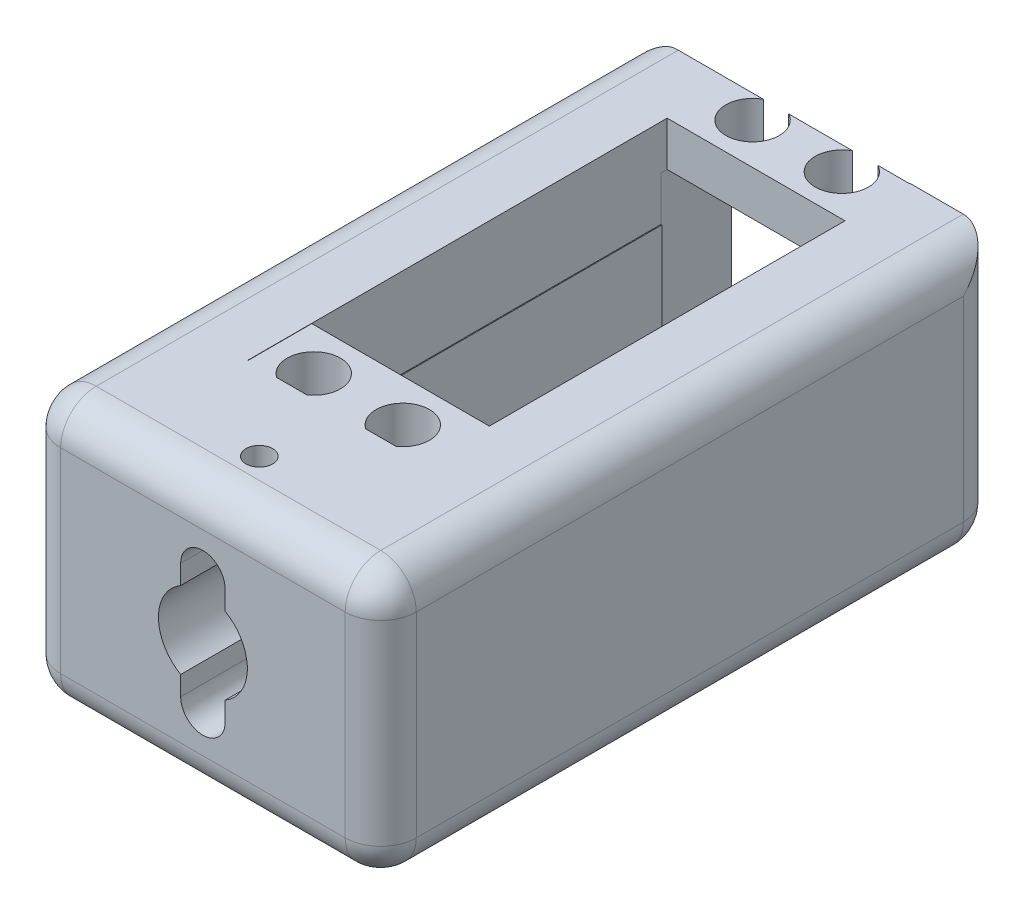
from build123d import *

# Parameters (mm, degrees)
SKETCH3_W            = 19.970710678
SKETCH3_H            = 7.220710678
BOSS_EXTRUDE2_DEPTH  = 10
SKETCH4_W            = 54.526496071
SKETCH4_H            = 10
BOSS_EXTRUDE3_DEPTH  = 10
SKETCH5_W            = 7.25
SKETCH5_H            = 10.1
BOSS_EXTRUDE4_DEPTH  = 20
SKETCH6_W            = 54.470710678
SKETCH6_H            = 10
BOSS_EXTRUDE5_DEPTH  = 10
SKETCH7_R            = 3
SKETCH7_R_2          = 2.998828916
CUT_EXTRUDE1_DEPTH   = 12
SKETCH8_R            = 3
CUT_EXTRUDE2_DEPTH   = 12
SKETCH9_W            = 40
SKETCH9_H            = 54.526496071
SKETCH9_W_2          = 19.9
SKETCH9_H_2          = 40
BOSS_EXTRUDE8_DEPTH  = 12
SKETCH10_W           = 20.059980773
SKETCH10_H           = 17
CUT_EXTRUDE6_DEPTH   = 8
SKETCH11_W           = 40
SKETCH11_H           = 22
BOSS_EXTRUDE9_DEPTH  = 5
SKETCH12_W           = 7.25
SKETCH12_H           = 0.1
CUT_EXTRUDE7_DEPTH   = 20
SKETCH13_W           = 20
SKETCH13_H           = 17
CUT_EXTRUDE8_DEPTH   = 20
SKETCH16_W           = 40
SKETCH16_H           = 59.526496071
BOSS_EXTRUDE11_DEPTH = 8
SKETCH17_W           = 20
SKETCH17_H           = 40
CUT_EXTRUDE10_DEPTH  = 5
SKETCH19_W           = 40
SKETCH19_H           = 30
BOSS_EXTRUDE12_DEPTH = 10
CUT_EXTRUDE11_DEPTH  = 8
SKETCH21_R           = 1.5
CUT_EXTRUDE12_DEPTH  = 30
FILLET2_R            = 4


with BuildPart() as part:
    # Sketch3 → Boss-Extrude2 (new body)
    with BuildSketch(Plane.XZ.offset(-27.7)):
        with Locations((0.014644661, 3.610355339)):
            Rectangle(SKETCH3_W, SKETCH3_H)
    extrude(amount=BOSS_EXTRUDE2_DEPTH)

    # Sketch4 → Boss-Extrude3 (add)
    with BuildSketch(Plane(origin=(10, 0, 0), x_dir=(0, 0, -1), z_dir=(1, 0, 0))):
        with Locations((20.042537357, 22.7)):
            Rectangle(SKETCH4_W, SKETCH4_H)
    extrude(amount=BOSS_EXTRUDE3_DEPTH)

    # Sketch5 → Boss-Extrude4 (add)
    with BuildSketch(Plane.ZY.offset(-10)):
        with Locations((-43.625, 22.75)):
            Rectangle(SKETCH5_W, SKETCH5_H)
    extrude(amount=BOSS_EXTRUDE4_DEPTH)

    # Sketch6 → Boss-Extrude5 (add)
    with BuildSketch(Plane.ZY.offset(10)):
        with Locations((-20.014644661, 22.7)):
            Rectangle(SKETCH6_W, SKETCH6_H)
    extrude(amount=BOSS_EXTRUDE5_DEPTH)

    # Sketch7 → Cut-Extrude1 (cut)
    with BuildSketch(Plane(origin=(0, 27.8, 0), x_dir=(1, 0, 0), z_dir=(0, 1, 0))):
        with Locations((-5.000552171, 44.609234731)):
            Circle(SKETCH7_R)
        with Locations((5.037134364, 44.609234731)):
            Circle(SKETCH7_R_2)
    extrude(amount=-CUT_EXTRUDE1_DEPTH, mode=Mode.SUBTRACT)

    # Sketch8 → Cut-Extrude2 (cut)
    with BuildSketch(Plane(origin=(0, 27.7, 0), x_dir=(1, 0, 0), z_dir=(0, 1, 0))):
        with Locations((-5, -4.75)):
            Circle(SKETCH8_R)
        with Locations((5.014644661, -4.75)):
            Circle(SKETCH8_R)
    extrude(amount=-CUT_EXTRUDE2_DEPTH, mode=Mode.SUBTRACT)

    # Sketch9 → Boss-Extrude8 (add)
    with BuildSketch(Plane.XZ.offset(-17.7)):
        with Locations((0, -20.042537357)):
            Rectangle(SKETCH9_W, SKETCH9_H)
        with Locations((0.05, -20)):
            Rectangle(SKETCH9_W_2, SKETCH9_H_2, mode=Mode.SUBTRACT)
    extrude(amount=BOSS_EXTRUDE8_DEPTH)

    # Sketch10 → Cut-Extrude6 (cut)
    with BuildSketch(Plane(origin=(0, 0, -47.305785393), x_dir=(-1, 0, 0), z_dir=(0, 0, -1))):
        with Locations((0.029990387, 14.2)):
            Rectangle(SKETCH10_W, SKETCH10_H)
    extrude(amount=-CUT_EXTRUDE6_DEPTH, mode=Mode.SUBTRACT)

    # Sketch11 → Boss-Extrude9 (add)
    with BuildSketch(Plane.XY.offset(7.220710678)):
        with Locations((0, 16.7)):
            Rectangle(SKETCH11_W, SKETCH11_H)
    extrude(amount=BOSS_EXTRUDE9_DEPTH)

    # Sketch12 → Cut-Extrude7 (cut)
    with BuildSketch(Plane(origin=(10, 0, 0), x_dir=(0, 0, -1), z_dir=(1, 0, 0))):
        with Locations((43.625, 27.75)):
            Rectangle(SKETCH12_W, SKETCH12_H)
    extrude(amount=-CUT_EXTRUDE7_DEPTH, mode=Mode.SUBTRACT)

    # Sketch13 → Cut-Extrude8 (cut)
    with BuildSketch(Plane.XY.offset(12.220710678)):
        with Locations((0, 14.2)):
            Rectangle(SKETCH13_W, SKETCH13_H)
    extrude(amount=-CUT_EXTRUDE8_DEPTH, mode=Mode.SUBTRACT)

    # Sketch16 → Boss-Extrude11 (add)
    with BuildSketch(Plane.XZ.offset(-5.7)):
        with Locations((0, -17.542537357)):
            Rectangle(SKETCH16_W, SKETCH16_H)
    extrude(amount=BOSS_EXTRUDE11_DEPTH)

    # Sketch17 → Cut-Extrude10 (cut)
    with BuildSketch(Plane(origin=(0, 5.7, 0), x_dir=(1, 0, 0), z_dir=(0, 1, 0))):
        with Locations((0, 20)):
            Rectangle(SKETCH17_W, SKETCH17_H)
    extrude(amount=-CUT_EXTRUDE10_DEPTH, mode=Mode.SUBTRACT)

    # Sketch19 → Boss-Extrude12 (add)
    with BuildSketch(Plane.XY.offset(12.220710678)):
        with Locations((0, 12.7)):
            Rectangle(SKETCH19_W, SKETCH19_H)
    extrude(amount=BOSS_EXTRUDE12_DEPTH)

    # Sketch20 → Cut-Extrude11 (cut)
    with BuildSketch(Plane.XY.offset(22.220710678)):
        with BuildLine():
            Line((-2.5, 6.2), (-2.5, 8.369872981))
            ThreePointArc((-2.5, 8.369872981), (-5, 12.7), (-2.5, 17.030127019))
            Line((-2.5, 17.030127019), (-2.5, 19.2))
            ThreePointArc((-2.5, 19.2), (0, 21.7), (2.5, 19.2))
            Line((2.5, 19.2), (2.5, 17.030127019))
            ThreePointArc((2.5, 17.030127019), (5, 12.7), (2.5, 8.369872981))
            Line((2.5, 8.369872981), (2.5, 6.2))
            ThreePointArc((2.5, 6.2), (0, 3.7), (-2.5, 6.2))
        make_face()
    extrude(amount=-CUT_EXTRUDE11_DEPTH, mode=Mode.SUBTRACT)

    # Sketch21 → Cut-Extrude12 (cut)
    with BuildSketch(Plane(origin=(0, 27.7, 0), x_dir=(1, 0, 0), z_dir=(0, 1, 0))):
        with Locations(Location((0, -15.870882648, 0), (0, 0, 270))):
            Circle(SKETCH21_R)
    extrude(amount=-CUT_EXTRUDE12_DEPTH, mode=Mode.SUBTRACT)

    # Fillet2
    # the kernel refuses this fillet: 4 mm, written as the material it takes off along each edge
    with BuildSketch(Plane(origin=(16, 23.7, 18.220710678), x_dir=(1, 0, 0), z_dir=(0, 1, 0))) as fillet2_piece_1_section:
        Polygon((0, 0), (FILLET2_R, 0), (FILLET2_R, -FILLET2_R), (0, -FILLET2_R), align=None)
    fillet2_piece_1 = extrude(amount=FILLET2_R, mode=Mode.PRIVATE)
    fillet2_piece_1 = fillet2_piece_1 - Plane(origin=(16, 23.7, 18.220710678), x_dir=(-0.7071067811865475, 0, -0.7071067811865475), z_dir=(0, 1, 0)) * Sphere(FILLET2_R, mode=Mode.PRIVATE)
    add(fillet2_piece_1, mode=Mode.SUBTRACT)
    with BuildSketch(Plane(origin=(-16, 23.7, 18.220710678), x_dir=(0, 1, 0), z_dir=(-1, 0, 0))) as fillet2_piece_2_section:
        Polygon((0, 0), (FILLET2_R, 0), (FILLET2_R, -FILLET2_R), (0, -FILLET2_R), align=None)
    fillet2_piece_2 = extrude(amount=FILLET2_R, mode=Mode.PRIVATE)
    fillet2_piece_2 = fillet2_piece_2 - Plane(origin=(-16, 23.7, 18.220710678), x_dir=(0, -0.7071067811865475, -0.7071067811865475), z_dir=(-1, 0, 0)) * Sphere(FILLET2_R, mode=Mode.PRIVATE)
    add(fillet2_piece_2, mode=Mode.SUBTRACT)
    with BuildSketch(Plane(origin=(-16, 1.7, -43.305785393), x_dir=(0, 0, -1), z_dir=(-1, 0, 0))) as fillet2_piece_3_section:
        Polygon((0, 0), (FILLET2_R, 0), (FILLET2_R, FILLET2_R), (0, FILLET2_R), align=None)
    fillet2_piece_3 = extrude(amount=FILLET2_R, mode=Mode.PRIVATE)
    fillet2_piece_3 = fillet2_piece_3 - Plane(origin=(-16, 1.7, -43.305785393), x_dir=(0, 0.7071067811865475, 0.7071067811865475), z_dir=(-1, 0, 0)) * Sphere(FILLET2_R, mode=Mode.PRIVATE)
    add(fillet2_piece_3, mode=Mode.SUBTRACT)
    with BuildSketch(Plane(origin=(-16, 1.7, 18.220710678), x_dir=(0, 0, 1), z_dir=(-1, 0, 0))) as fillet2_piece_4_section:
        Polygon((0, 0), (FILLET2_R, 0), (FILLET2_R, -FILLET2_R), (0, -FILLET2_R), align=None)
    fillet2_piece_4 = extrude(amount=FILLET2_R, mode=Mode.PRIVATE)
    fillet2_piece_4 = fillet2_piece_4 - Plane(origin=(-16, 1.7, 18.220710678), x_dir=(0, 0.7071067811865475, -0.7071067811865475), z_dir=(-1, 0, 0)) * Sphere(FILLET2_R, mode=Mode.PRIVATE)
    add(fillet2_piece_4, mode=Mode.SUBTRACT)
    with BuildSketch(Plane(origin=(16, 1.7, 18.220710678), x_dir=(1, 0, 0), z_dir=(0, -1, 0))) as fillet2_piece_5_section:
        Polygon((0, 0), (FILLET2_R, 0), (FILLET2_R, FILLET2_R), (0, FILLET2_R), align=None)
    fillet2_piece_5 = extrude(amount=FILLET2_R, mode=Mode.PRIVATE)
    fillet2_piece_5 = fillet2_piece_5 - Plane(origin=(16, 1.7, 18.220710678), x_dir=(-0.7071067811865475, 0, -0.7071067811865475), z_dir=(0, -1, 0)) * Sphere(FILLET2_R, mode=Mode.PRIVATE)
    add(fillet2_piece_5, mode=Mode.SUBTRACT)
    with BuildSketch(Plane(origin=(16, 1.7, -43.305785393), x_dir=(0, 0, -1), z_dir=(0, -1, 0))) as fillet2_piece_6_section:
        Polygon((0, 0), (FILLET2_R, 0), (FILLET2_R, FILLET2_R), (0, FILLET2_R), align=None)
    fillet2_piece_6 = extrude(amount=FILLET2_R, mode=Mode.PRIVATE)
    fillet2_piece_6 = fillet2_piece_6 - Plane(origin=(16, 1.7, -43.305785393), x_dir=(-0.7071067811865475, 0, 0.7071067811865475), z_dir=(0, -1, 0)) * Sphere(FILLET2_R, mode=Mode.PRIVATE)
    add(fillet2_piece_6, mode=Mode.SUBTRACT)
    with BuildSketch(Plane(origin=(20, 27.7, 18.220710678), x_dir=(-1, 0, 0), z_dir=(0, 0, -1))) as fillet2_piece_7:
        with BuildLine():
            CenterArc((FILLET2_R, -FILLET2_R), FILLET2_R, 90, 90)
            Line((0, -FILLET2_R), (0, 0))
            Line((0, 0), (FILLET2_R, 0))
        make_face()
    extrude(amount=75.526496071, mode=Mode.SUBTRACT)
    with BuildSketch(Plane(origin=(-20, 27.7, -57.25), x_dir=(1, 0, 0), z_dir=(0, 0, 1))) as fillet2_piece_8:
        with BuildLine():
            CenterArc((FILLET2_R, -FILLET2_R), FILLET2_R, 90, 90)
            Line((0, -FILLET2_R), (0, 0))
            Line((0, 0), (FILLET2_R, 0))
        make_face()
    extrude(amount=75.470710678, mode=Mode.SUBTRACT)
    with BuildSketch(Plane(origin=(-20, -2.3, -43.305785393), x_dir=(0, 1, 0), z_dir=(0, 0, 1)), Plane(origin=(20, -2.3, 18.220710678), x_dir=(0, 1, 0), z_dir=(0, 0, -1))) as fillet2_piece_9:
        with BuildLine():
            CenterArc((FILLET2_R, -FILLET2_R), FILLET2_R, 90, 90)
            Line((0, -FILLET2_R), (0, 0))
            Line((0, 0), (FILLET2_R, 0))
        make_face()
    extrude(amount=61.526496071, mode=Mode.SUBTRACT)
    with BuildSketch(Plane(origin=(16, -2.3, -47.305785393), x_dir=(0, 1, 0), z_dir=(-1, 0, 0)), Plane(origin=(-16, 27.7, 22.220710678), x_dir=(0, 0, -1), z_dir=(1, 0, 0))) as fillet2_piece_10:
        with BuildLine():
            CenterArc((FILLET2_R, -FILLET2_R), FILLET2_R, 90, 90)
            Line((0, -FILLET2_R), (0, 0))
            Line((0, 0), (FILLET2_R, 0))
        make_face()
    extrude(amount=32, mode=Mode.SUBTRACT)
    with BuildSketch(Plane(origin=(16, -2.3, 22.220710678), x_dir=(0, 1, 0), z_dir=(-1, 0, 0))) as fillet2_piece_11:
        with BuildLine():
            CenterArc((FILLET2_R, FILLET2_R), FILLET2_R, 180, 90)
            Line((0, FILLET2_R), (0, 0))
            Line((0, 0), (FILLET2_R, 0))
        make_face()
    extrude(amount=32, mode=Mode.SUBTRACT)
    with BuildSketch(Plane(origin=(-20, 1.7, -47.305785393), x_dir=(1, 0, 0), z_dir=(0, 1, 0))) as fillet2_piece_12:
        with BuildLine():
            CenterArc((FILLET2_R, -FILLET2_R), FILLET2_R, 90, 90)
            Line((0, -FILLET2_R), (0, 0))
            Line((0, 0), (FILLET2_R, 0))
        make_face()
    extrude(amount=26, mode=Mode.SUBTRACT)
    with BuildSketch(Plane(origin=(20, 37.7, -47.305785393), x_dir=(-1, 0, 0), z_dir=(0, -1, 0))) as fillet2_piece_13:
        with BuildLine():
            CenterArc((FILLET2_R, -FILLET2_R), FILLET2_R, 90, 90)
            Line((0, -FILLET2_R), (0, 0))
            Line((0, 0), (FILLET2_R, 0))
        make_face()
    extrude(amount=36, mode=Mode.SUBTRACT)
    with BuildSketch(Plane(origin=(20, 23.7, 22.220710678), x_dir=(0, 0, -1), z_dir=(0, -1, 0))) as fillet2_piece_14:
        with BuildLine():
            CenterArc((FILLET2_R, -FILLET2_R), FILLET2_R, 90, 90)
            Line((0, -FILLET2_R), (0, 0))
            Line((0, 0), (FILLET2_R, 0))
        make_face()
    extrude(amount=22, mode=Mode.SUBTRACT)
    with BuildSketch(Plane(origin=(-20, 1.7, 22.220710678), x_dir=(1, 0, 0), z_dir=(0, 1, 0))) as fillet2_piece_15:
        with BuildLine():
            CenterArc((FILLET2_R, FILLET2_R), FILLET2_R, 180, 90)
            Line((0, FILLET2_R), (0, 0))
            Line((0, 0), (FILLET2_R, 0))
        make_face()
    extrude(amount=22, mode=Mode.SUBTRACT)


solid = part.part
